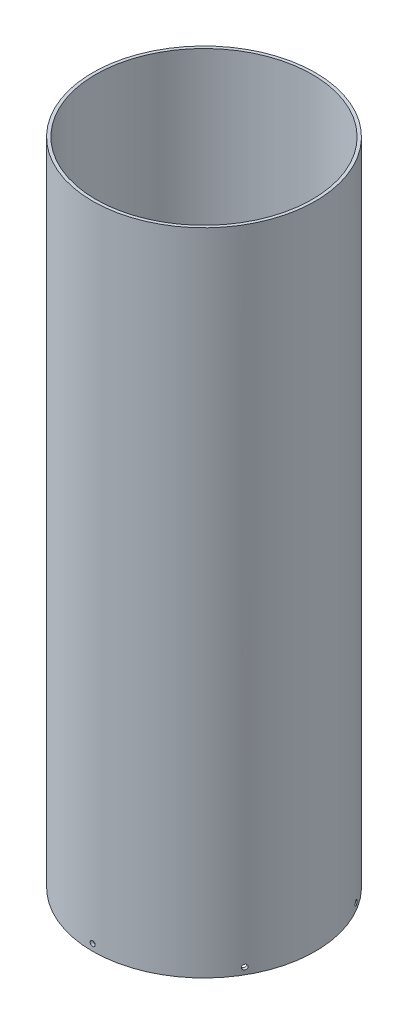
from build123d import *

# Parameters (mm, degrees)
SKETCH1_R           = 78.359
SKETCH1_R_2         = 76.2
BOSS_EXTRUDE1_DEPTH = 457.2
SKETCH2_R           = 1.750000056
CUT_EXTRUDE1_DEPTH  = 471.438206104
CIRPATTERN1_COUNT   = 6


with BuildPart() as part:
    # Sketch1 → Boss-Extrude1 (new body)
    with BuildSketch(Plane(origin=(0, 0, 0), x_dir=(1, 0, 0), z_dir=(0, 1, 0))):
        Circle(SKETCH1_R)
        Circle(SKETCH1_R_2, mode=Mode.SUBTRACT)
    extrude(amount=BOSS_EXTRUDE1_DEPTH)

    # Sketch2 → Cut-Extrude1 (cut, through all)
    with BuildSketch(Plane.XY):
        with Locations((0, 4.7625)):
            Circle(SKETCH2_R)
    cut_extrude1 = extrude(amount=-CUT_EXTRUDE1_DEPTH, mode=Mode.SUBTRACT)

    # CirPattern1: Cut-Extrude1 ×6 about axis
    cirpattern1_axis = Axis((0, 457.2, 0), (0, -1, 0))
    for i in range(1, CIRPATTERN1_COUNT):
        add(cut_extrude1.rotate(cirpattern1_axis, i * 360 / CIRPATTERN1_COUNT), mode=Mode.SUBTRACT)


solid = part.part
